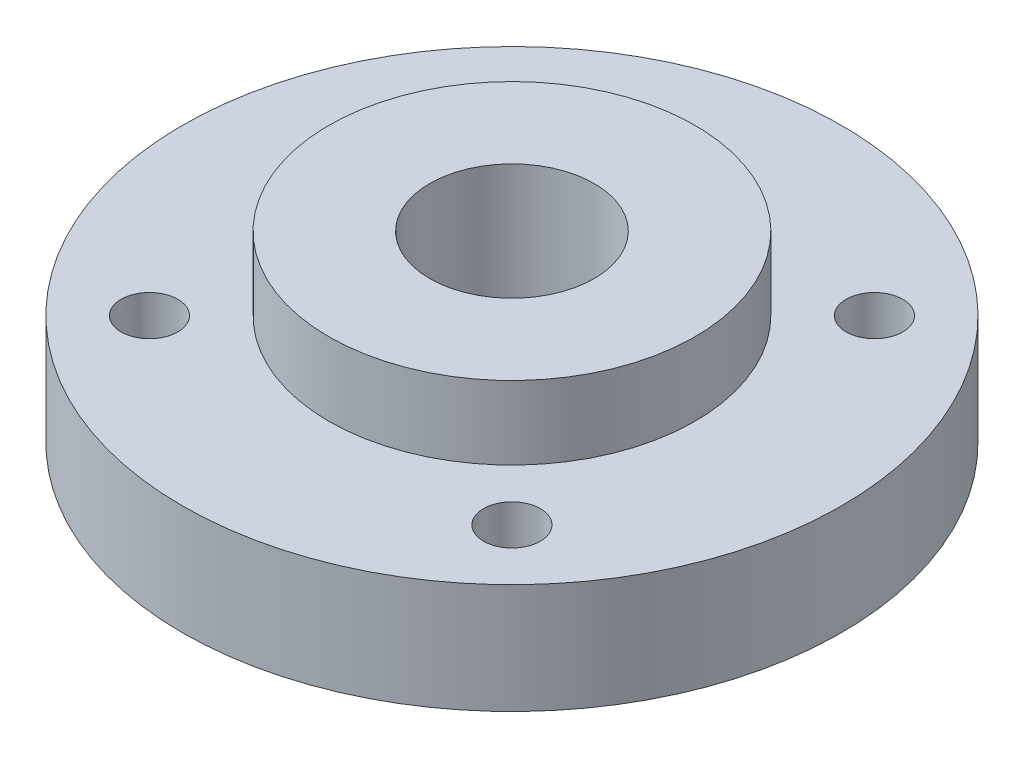
from build123d import *

# Parameters (mm, degrees)
F_10_0_1935_DIAMETER_HOLE1_D      = 4.9149
PIPE_TAP_DRILL_FOR_3_8_TAP1_D     = 14.2748
PIPE_TAP_DRILL_FOR_3_8_TAP1_DEPTH = 12.7
PIPE_TAP_DRILL_FOR_3_8_TAP1_TIP   = 4.288582582


with BuildPart() as part:
    # Sketch1 → Revolve1 (revolve)
    with BuildSketch(Plane.XY):
        Polygon((-11.1125, -73.830212574), (-11.1125, -77.005212574), (-14.2875, -77.005212574), (-14.2875, -73.830212574), (-14.2875, -70.693312574), (-19.05, -70.693312574), (-19.05, -73.830212574), (-28.575, -73.830212574), (-28.575, -64.305212574), (-15.875, -64.305212574), (-15.875, -57.955212574), (-4.7625, -57.955212574), (-4.7625, -73.830212574), align=None)
    revolve(axis=Axis((0, 0, 0), (0, -1, 0)))

    # #10 (0.1935) Diameter Hole1 (through all)
    with Locations(Plane(origin=(0, -57.955212574, 0), x_dir=(1, 0, 0), z_dir=(0, 1, 0))):
        with Locations((15.715448212, 15.715448212), (-15.715448212, 15.715448212), (-15.715448212, -15.715448212), (15.715448212, -15.715448212)):
            Hole(F_10_0_1935_DIAMETER_HOLE1_D / 2)

    # Pipe Tap Drill for 3/8 Tap1
    with Locations(Plane.ZX.offset(-57.955212574)):
        with Locations((0, 0)):
            Hole(PIPE_TAP_DRILL_FOR_3_8_TAP1_D / 2, depth=PIPE_TAP_DRILL_FOR_3_8_TAP1_DEPTH)
            with Locations((0, 0, -(PIPE_TAP_DRILL_FOR_3_8_TAP1_DEPTH + PIPE_TAP_DRILL_FOR_3_8_TAP1_TIP / 2))):  # 118° drill point
                Cone(0, PIPE_TAP_DRILL_FOR_3_8_TAP1_D / 2, PIPE_TAP_DRILL_FOR_3_8_TAP1_TIP, mode=Mode.SUBTRACT)


solid = part.part
